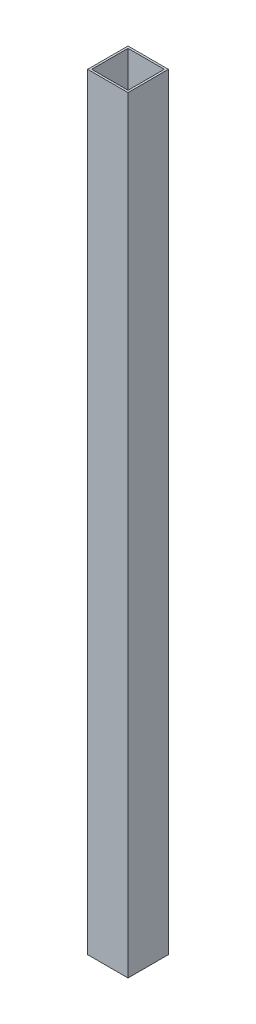
from build123d import *

# Parameters (mm, degrees)
SKETCH1_W           = 25.4
SKETCH1_H           = 25.4
BOSS_EXTRUDE1_DEPTH = 482.6


with BuildPart() as part:
    # Sketch1 → Boss-Extrude1 (new body)
    with BuildSketch(Plane(origin=(0, 0, 0), x_dir=(1, 0, 0), z_dir=(0, 1, 0))):
        with Locations((12.7, 12.7)):
            Rectangle(SKETCH1_W, SKETCH1_H)
        Polygon((1.27, 12.361459156), (1.27, 24.13), (12.7, 24.13), (24.13, 24.13), (24.13, 12.7), (24.13, 1.27), (12.7, 1.27), (1.27, 1.27), align=None, mode=Mode.SUBTRACT)
    extrude(amount=BOSS_EXTRUDE1_DEPTH)


solid = part.part
